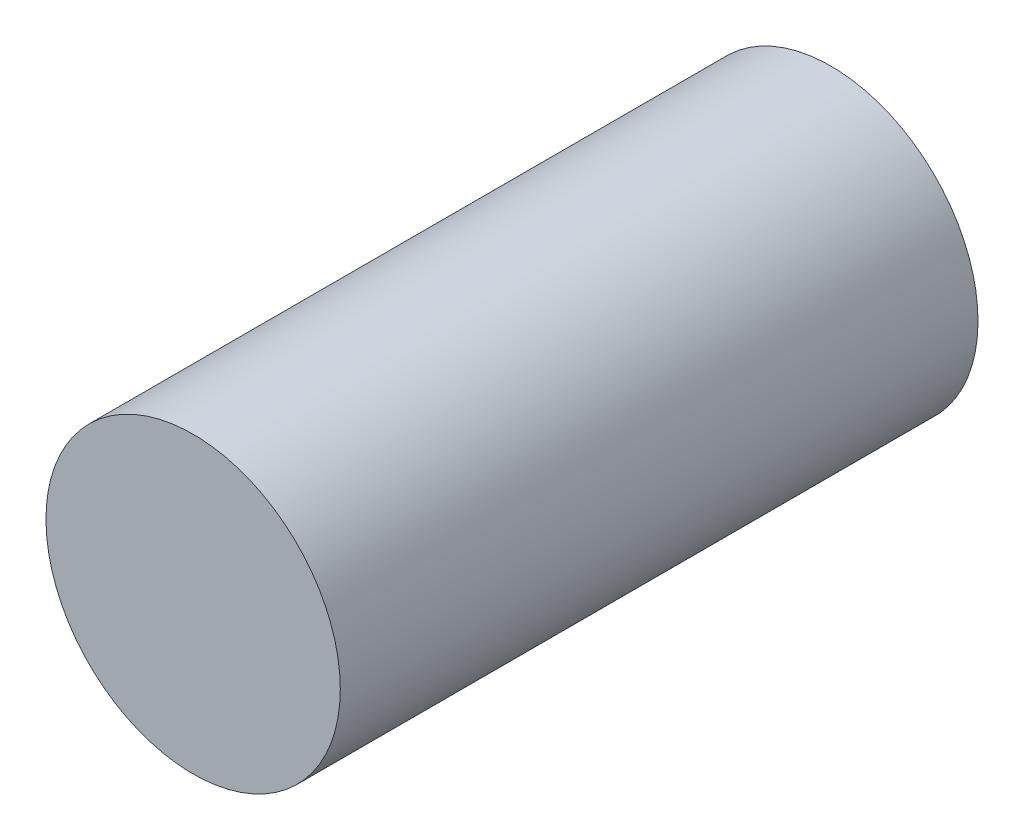
from build123d import *

# Parameters (mm, degrees)
SZKIC1_R                        = 3
DODANIE_WYCI_GNI_CIE1_DEPTH     = 13
SZKIC2_R                        = 3.83
DODANIE_WYCI_GNI_CIE2_DEPTH     = 9
GWINT1_PITCH                    = 1.25
SZKIC6_R                        = 6
DODANIE_WYCI_GNI_CIE3_DEPTH     = 2
SZKIC8_W                        = 15.88
SZKIC8_H                        = 21.21
DODANIE_WYCI_GNI_CIE4_DEPTH     = 14
ZAOKR_GLENIE1_R                 = 2
WYTNIJ_WYCI_GNI_CIE1_DEPTH      = 9
DODANIE_WYCI_GNI_CIE6_OUTLINE_W = 1
DODANIE_WYCI_GNI_CIE6_OUTLINE_H = 2
DODANIE_WYCI_GNI_CIE6_ANGLE     = 180
DODANIE_WYCI_GNI_CIE7_START     = 24
DODANIE_WYCI_GNI_CIE7_DEPTH     = 1
WYTNIJ_WYCI_GNI_CIE2_START      = -13
SZKIC11_R                       = 50
WYTNIJ_WYCI_GNI_CIE2_DEPTH      = 28.69554901


# Read off the part's stored shape, not the designer's step: Dodanie-wyciągnięcie6
with BuildPart() as part:
    # Szkic1 → Dodanie-wyciągnięcie1 (new body)
    with BuildSketch(Plane.XY):
        with Locations(Location((0, 0, 0), (0, 0, 180))):
            Circle(SZKIC1_R)
    extrude(amount=DODANIE_WYCI_GNI_CIE1_DEPTH)

    # Szkic2 → Dodanie-wyciągnięcie2 (add)
    with BuildSketch(Plane.XY.offset(13)):
        Circle(SZKIC2_R)
    extrude(amount=DODANIE_WYCI_GNI_CIE2_DEPTH)

    # Gwint1: the profile of Profil gwintu1 profile screwed along a right-hand helix of 8 turns, 8 arcs to a turn; built about Z, then put on its axis
    gwint1_z = Axis((0, 0, 0), (0, 0, 1))
    gwint1_corners = [(3.8297, 0, -0.000173205), (4.506582344, 0, 0.390624998), (4.506582344, 0, 0.546874998), (3.8297, 0, 0.937673202)]
    with BuildLine(mode=Mode.PRIVATE) as gwint1_profile:
        Line(gwint1_corners[0], gwint1_corners[1])
        Line(gwint1_corners[1], gwint1_corners[2])
        Line(gwint1_corners[2], gwint1_corners[3])
        Line(gwint1_corners[3], gwint1_corners[0])
    gwint1_cap = Face(gwint1_profile.wire())
    gwint1_turn_angles = [0, 22.5, 45, 67.5, 90, 112.5, 135, 157.5, 180, 202.5, 225, 247.5, 270, 292.5, 315, 337.5, 360]
    gwint1_turn_weights = [1, 0.9238795325112867, 1, 0.9238795325112867, 1, 0.9238795325112867, 1, 0.9238795325112867, 1, 0.9238795325112867, 1, 0.9238795325112867, 1, 0.9238795325112867, 1, 0.9238795325112867, 1]
    gwint1_turn_rails = [Edge.make_bspline([Vector(p[0], p[1], 0).rotate(gwint1_z, gwint1_turn_angles[k]) / gwint1_turn_weights[k] + Vector(0, 0, p[2] + GWINT1_PITCH * gwint1_turn_angles[k] / 360) for k in range(17)], [0, 0, 0, 1, 1, 2, 2, 3, 3, 4, 4, 5, 5, 6, 6, 7, 7, 8, 8, 8], 2, gwint1_turn_weights) for p in gwint1_corners]
    gwint1_turn_sides = [Face.make_surface_from_curves(gwint1_turn_rails[p[0]], gwint1_turn_rails[p[1]]) for p in [(0, 1), (1, 2), (2, 3), (3, 0)]]
    gwint1 = Plane(origin=(0, 0, 13), x_dir=(1, 0, 0), z_dir=(0, 0, 1)) * Solid(Shell([*[p.moved(Location((0, 0, GWINT1_PITCH * i))) for i in range(8) for p in gwint1_turn_sides], gwint1_cap, gwint1_cap.rotate(gwint1_z, 2880).moved(Location((0, 0, GWINT1_PITCH * 2880 / 360)))]))
    add(gwint1)

    # Szkic6 → Dodanie-wyciągnięcie3 (add)
    with BuildSketch(Plane.XY.offset(22)):
        Circle(SZKIC6_R)
    extrude(amount=DODANIE_WYCI_GNI_CIE3_DEPTH)

    # Szkic8 → Dodanie-wyciągnięcie4 (add)
    with BuildSketch(Plane.XY.offset(24)):
        with Locations((0, -1.605)):
            Rectangle(SZKIC8_W, SZKIC8_H)
    extrude(amount=DODANIE_WYCI_GNI_CIE4_DEPTH)

    # Zaokrąglenie1
    zaokr_glenie1_edges = [part.edges().sort_by_distance(p)[0] for p in [
        (-7.94, -1.605, 24),
        (-7.94, 9, 31),
        (0, -12.21, 24),
        (-7.94, -12.21, 31),
        (7.94, -1.605, 24),
        (7.94, -12.21, 31),
        (0, 9, 24),
        (7.94, 9, 31),
    ]]
    fillet(zaokr_glenie1_edges, radius=ZAOKR_GLENIE1_R)

    # Szkic9 → Wytnij-wyciągnięcie1 (cut)
    with BuildSketch(Plane(origin=(0, 0, 0), x_dir=(-1, 0, 0), z_dir=(0, 0, -1))):
        Polygon((-1.596370884, -2.54), (1.596370884, -2.54), (8.034501067, -6.687500384), (-7.848069709, -6.190255995), align=None)
    extrude(amount=-WYTNIJ_WYCI_GNI_CIE1_DEPTH, mode=Mode.SUBTRACT)

    # Dodanie-wyciągnięcie6 outline → Dodanie-wyciągnięcie6 (revolve)
    with BuildSketch(Plane.YZ.offset(7.94)):
        with Locations((0.5, 25)):
            Rectangle(DODANIE_WYCI_GNI_CIE6_OUTLINE_W, DODANIE_WYCI_GNI_CIE6_OUTLINE_H)
    revolve(axis=Axis((7.94, 0, 0), (0, 0, 1)), revolution_arc=DODANIE_WYCI_GNI_CIE6_ANGLE)

    # Szkic10<2> → Dodanie-wyciągnięcie7 (add)
    with BuildSketch(Plane.XY.offset(DODANIE_WYCI_GNI_CIE7_START)):
        with BuildLine():
            Line((7.94, 0), (7.94, 1))
            ThreePointArc((7.94, 1), (6.94, 0), (7.94, -1))
            Line((7.94, -1), (7.94, 0))
        make_face()
    extrude(amount=-DODANIE_WYCI_GNI_CIE7_DEPTH)

    # Szkic11 → Wytnij-wyciągnięcie2 (cut, through all)
    with BuildSketch(Plane(origin=(0, 0, 0), x_dir=(-1, 0, 0), z_dir=(0, 0, -1)).offset(WYTNIJ_WYCI_GNI_CIE2_START)):
        Circle(SZKIC11_R)
    extrude(amount=-WYTNIJ_WYCI_GNI_CIE2_DEPTH, mode=Mode.SUBTRACT)


with BuildPart() as wytnij_wyci_gni_cie2_kept_piece:
    # of the separate pieces the step leaves, the one the design keeps (wytnij_wyci_gni_cie2_pieces_kept)
    add(part.part.solids().sort_by_distance((-3, 0, 0))[0])


solid = wytnij_wyci_gni_cie2_kept_piece.part
